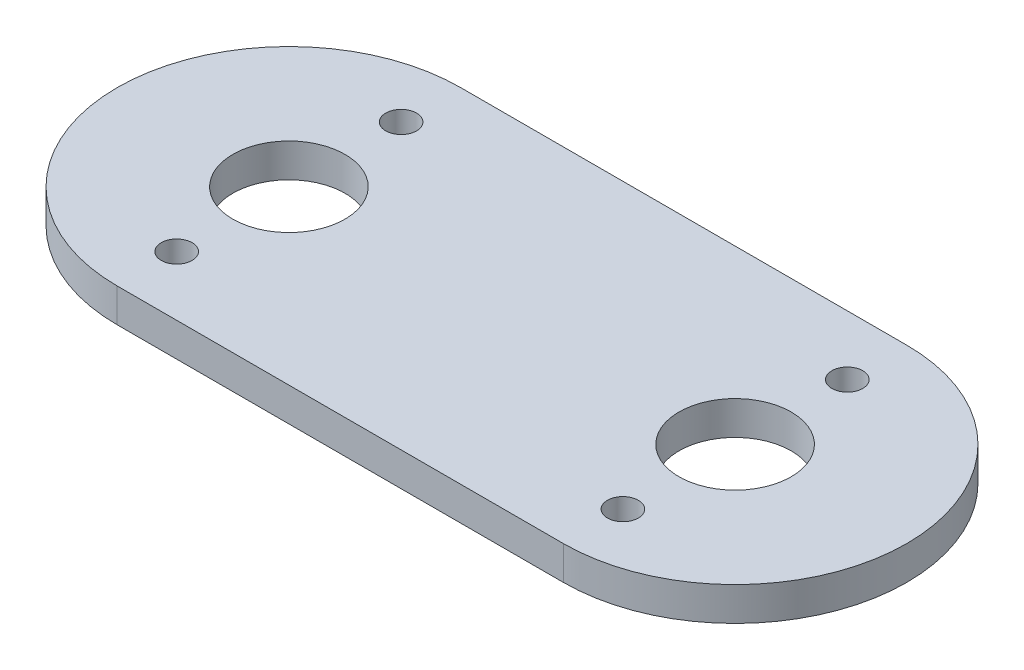
from build123d import *

# Parameters (mm, degrees)
BOSS_EXTRUDE1_DEPTH = 3
SKETCH2_R           = 5
SKETCH2_R_2         = 1.375
CUT_EXTRUDE1_DEPTH  = 57.401986652


with BuildPart() as part:
    # Sketch1 → Boss-Extrude1 (new body)
    with BuildSketch(Plane(origin=(0, 0, 0), x_dir=(1, 0, 0), z_dir=(0, 1, 0))):
        with BuildLine():
            Line((-31.972318339, 0), (7.785985851, 0))
            ThreePointArc((7.785985851, 0), (23.091295391, -15.30530954), (7.785985851, -30.61061908))
            Line((7.785985851, -30.61061908), (-31.972318339, -30.61061908))
            ThreePointArc((-31.972318339, -30.61061908), (-47.277627879, -15.30530954), (-31.972318339, 0))
        make_face()
    extrude(amount=BOSS_EXTRUDE1_DEPTH)

    # Sketch2 → Cut-Extrude1 (cut, through all)
    with BuildSketch(Plane(origin=(0, 3, 0), x_dir=(1, 0, 0), z_dir=(0, 1, 0))):
        with Locations((-31.972318339, -15.30530954)):
            Circle(SKETCH2_R)
        with Locations((-31.972318339, -5.30530954)):
            Circle(SKETCH2_R_2)
        with Locations((-31.972318339, -25.30530954)):
            Circle(SKETCH2_R_2)
        with Locations((7.785985851, -5.30530954)):
            Circle(SKETCH2_R_2)
        with Locations((7.785985851, -15.30530954)):
            Circle(SKETCH2_R)
        with Locations((7.785985851, -25.30530954)):
            Circle(SKETCH2_R_2)
    extrude(amount=-CUT_EXTRUDE1_DEPTH, mode=Mode.SUBTRACT)


solid = part.part
